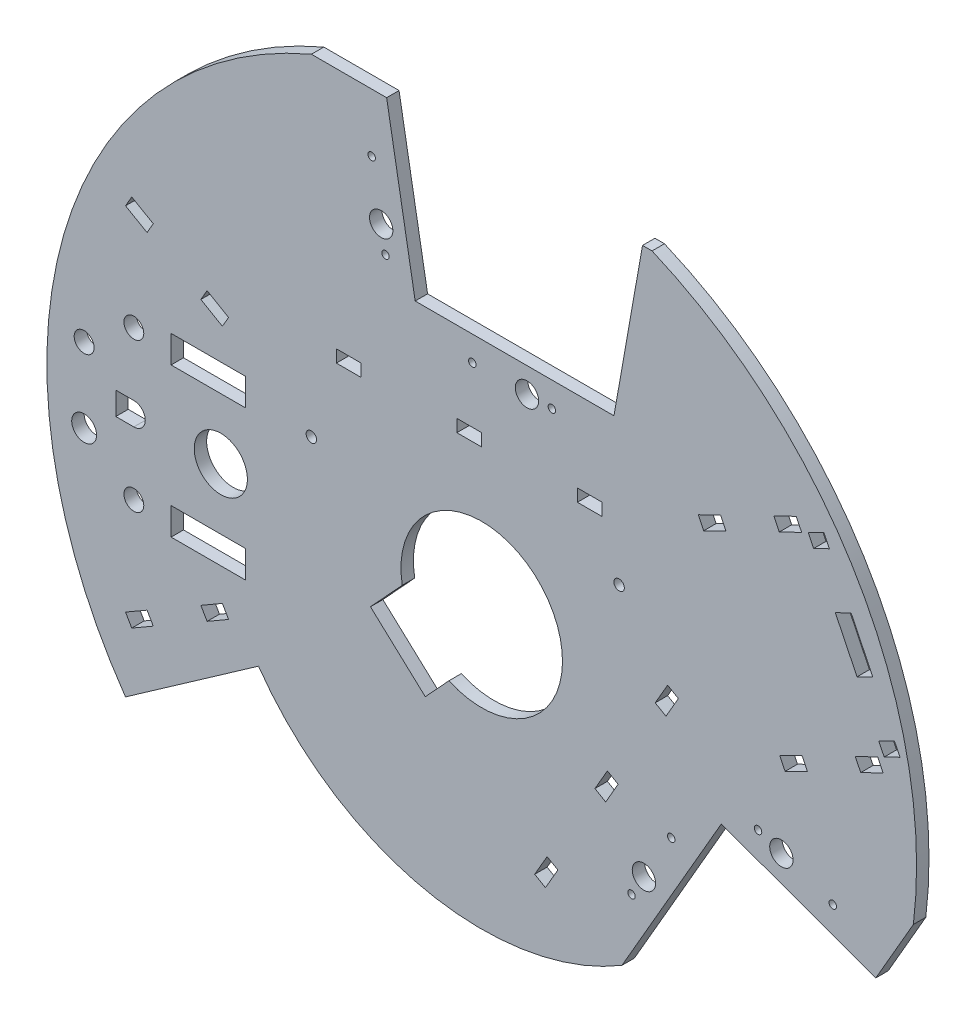
from build123d import *

# Parameters (mm, degrees)
ESQUISSE1_R                   = 175
BOSS_EXTRU_1_DEPTH            = 5
ESQUISSE2_R                   = 4.7
ENL_V_MAT_EXTRU_1_DEPTH       = 5
LEDS_BOUT_TIRETTE_R           = 10.7
LEDS_BOUT_TIRETTE_R_2         = 4
LEDS_BOUT_TIRETTE_R_3         = 5
LEDS_BOUT_TIRETTE_W           = 30
LEDS_BOUT_TIRETTE_H           = 11
LEDS_BUTTONS_DEPTH            = 10
FIXATION_ACENSSEURS_R         = 1.5
ENL_V_MAT_EXTRU_2_DEPTH       = 10
ENL_V_MAT_EXTRU_3_DEPTH       = 10
ENL_V_MAT_EXTRU_4_DEPTH       = 10
ENL_V_START                   = -2.417292656
ENL_V_MAT_EXTRU_5_OUTLINE_W   = 7.070312755
ENL_V_MAT_EXTRU_5_OUTLINE_H   = 5
ENL_V_MAT_EXTRU_5_DEPTH       = 20
ENL_V_START_2                 = -32.417292656
ENL_V_MAT_EXTRU_5_2_OUTLINE_W = 10
ENL_V_MAT_EXTRU_5_2_OUTLINE_H = 5
ENL_V_MAT_EXTRU_5_2_DEPTH     = 5
ENL_V_START_3                 = 42.582707344
ENL_V_MAT_EXTRU_5_3_OUTLINE_W = 10
ENL_V_MAT_EXTRU_5_3_OUTLINE_H = 5
ENL_V_MAT_EXTRU_5_3_DEPTH     = 5
ENL_V_START_4                 = -27.417292656
ENL_V_MAT_EXTRU_5_4_OUTLINE_W = 7.070312755
ENL_V_MAT_EXTRU_5_4_OUTLINE_H = 5
ENL_V_MAT_EXTRU_5_4_DEPTH     = 5
ENL_V_START_5                 = 37.582707344
ENL_V_MAT_EXTRU_5_5_OUTLINE_W = 7.070312755
ENL_V_MAT_EXTRU_5_5_OUTLINE_H = 5
ENL_V_MAT_EXTRU_5_5_DEPTH     = 5
ESQUISSE8_W                   = 10
ESQUISSE8_H                   = 5
ENL_V_MAT_EXTRU_6_DEPTH       = 5
ENL_V_MAT_EXTRU_7_DEPTH       = 10
TROU_TARAUD_M51_D             = 4.2


# Read off the part's stored shape, not the designer's step: Enlèv. mat.-Extru.5
with BuildPart() as part:
    # Esquisse1 → Boss.-Extru.1 (new body)
    with BuildSketch(Plane.XY):
        Circle(ESQUISSE1_R)
    extrude(amount=BOSS_EXTRU_1_DEPTH)

    # Esquisse2 → Enlèv. mat.-Extru.1 (cut)
    with BuildSketch(Plane(origin=(0, 0, 0), x_dir=(-1, 0, 0), z_dir=(0, 0, -1))):
        with Locations((-18.220426897, 85.887612711)):
            Circle(ESQUISSE2_R)
        with Locations((40.460378836, 115.887612711)):
            Circle(ESQUISSE2_R)
        with Locations((-65.270641029, -58.723158916)):
            Circle(ESQUISSE2_R)
        with Locations((-120.59180601, -22.904090436)):
            Circle(ESQUISSE2_R)
        Polygon((26.7795731, 95.88761271), (38.263317053, 161.015161015), (68.550112498, 161.015161015), (68.550112498, 190.246123658), (-94.990966298, 190.246123658), (-94.990966298, 161.015161015), (-64.704170853, 161.015161015), (-53.2204269, 95.88761271), align=None)
        Polygon((-96.430895065, -24.752015748), (-158.57487836, -47.370575906), (-173.718276082, -21.141441652), (-199.033032308, -35.756922974), (-117.262492911, -177.387651773), (-91.947736684, -162.772170451), (-107.091134406, -136.543036197), (-56.430895065, -94.034048051), align=None)
    extrude(amount=-ENL_V_MAT_EXTRU_1_DEPTH, mode=Mode.SUBTRACT)

    # Leds, bout., tirette → Leds, buttons (cut)
    with BuildSketch(Plane.XY.offset(5)):
        with Locations((-105, 0)):
            Circle(LEDS_BOUT_TIRETTE_R)
        with Locations((-140, 30)):
            Circle(LEDS_BOUT_TIRETTE_R_2)
        with Locations((-140, -30)):
            Circle(LEDS_BOUT_TIRETTE_R_2)
        with Locations((-160, 15)):
            Circle(LEDS_BOUT_TIRETTE_R_2)
        with Locations((-160, -15)):
            Circle(LEDS_BOUT_TIRETTE_R_3)
        with BuildLine():
            Line((-140, -4.6), (-147.25, -4.6))
            Line((-147.25, -4.6), (-147.25, 4.6))
            Line((-147.25, 4.6), (-140, 4.6))
            ThreePointArc((-140, 4.6), (-135.4, 0), (-140, -4.6))
        make_face()
        with Locations((-110, 30)):
            Rectangle(LEDS_BOUT_TIRETTE_W, LEDS_BOUT_TIRETTE_H)
        with Locations((-110, -30)):
            Rectangle(LEDS_BOUT_TIRETTE_W, LEDS_BOUT_TIRETTE_H)
    extrude(amount=-LEDS_BUTTONS_DEPTH, mode=Mode.SUBTRACT)

    # Fixation acensseurs → Enlèv. mat.-Extru.2 (cut)
    with BuildSketch(Plane(origin=(0, 0, 0), x_dir=(-1, 0, 0), z_dir=(0, 0, -1))):
        with Locations((38.72389706, 106.03953518)):
            Circle(FIXATION_ACENSSEURS_R)
        with Locations((-28.220426897, 85.887612711)):
            Circle(FIXATION_ACENSSEURS_R)
        with Locations((44.280638745, 137.553383277)):
            Circle(FIXATION_ACENSSEURS_R)
        with Locations((3.779573103, 85.887612711)):
            Circle(FIXATION_ACENSSEURS_R)
        with Locations((-111.194879802, -19.483889003)):
            Circle(FIXATION_ACENSSEURS_R)
        with Locations((-60.270641029, -67.383412953)):
            Circle(FIXATION_ACENSSEURS_R)
        with Locations((-141.265043667, -30.428533589)):
            Circle(FIXATION_ACENSSEURS_R)
        with Locations((-76.270641029, -39.670600032)):
            Circle(FIXATION_ACENSSEURS_R)
    extrude(amount=-ENL_V_MAT_EXTRU_2_DEPTH, mode=Mode.SUBTRACT)

    # Esquisse3 → Enlèv. mat.-Extru.3 (cut)
    with BuildSketch(Plane(origin=(0, 0, 0), x_dir=(-1, 0, 0), z_dir=(0, 0, -1))):
        with BuildLine():
            Line((22.704747883, -39.988138527), (44.77437947, -19.667425901))
            Line((44.77437947, -19.667425901), (31.982809207, -5.77493855))
            ThreePointArc((31.982809207, -5.77493855), (-25.570164707, 20.060325942), (13.221748658, -29.68897712))
            Line((13.221748658, -29.68897712), (22.704747883, -39.988138527))
        make_face()
    extrude(amount=-ENL_V_MAT_EXTRU_3_DEPTH, mode=Mode.SUBTRACT)

    # Esquisse4 → Enlèv. mat.-Extru.4 (cut)
    with BuildSketch(Plane(origin=(0, 0, -5), x_dir=(-1, 0, 0), z_dir=(0, 0, -1))):
        Polygon((134.678427666, -65.79510224), (143.338681704, -70.79510224), (140.838681704, -75.125229259), (132.178427666, -70.125229259), align=None)
        Polygon((101.867538534, -52.625229259), (110.527792572, -57.625229259), (113.027792572, -53.29510224), (104.367538534, -48.29510224), align=None)
        Polygon((104.367538534, 48.29510224), (101.867538534, 52.625229259), (110.527792572, 57.625229259), (113.027792572, 53.29510224), align=None)
        Polygon((132.178427666, 70.125229259), (134.678427666, 65.79510224), (143.338681704, 70.79510224), (140.838681704, 75.125229259), align=None)
    extrude(amount=-ENL_V_MAT_EXTRU_4_DEPTH, mode=Mode.SUBTRACT)

    # Enlèv. mat.-Extru.5 outline → Enlèv. mat.-Extru.5 (cut)
    with BuildSketch(Plane(origin=(0, 0, 0), x_dir=(0.899482426544107, 0.4369569364803871, 0), z_dir=(0.4369569364803871, -0.8994824265441071, 0)).offset(ENL_V_START)):
        with Locations((162.91185011, 2.5)):
            Rectangle(ENL_V_MAT_EXTRU_5_OUTLINE_W, ENL_V_MAT_EXTRU_5_OUTLINE_H)
    extrude(amount=ENL_V_MAT_EXTRU_5_DEPTH, mode=Mode.SUBTRACT)

    # Enl_v. mat.-Extru.5 2 outline → Enl_v. mat.-Extru.5 2 (cut)
    with BuildSketch(Plane(origin=(0, 0, 0), x_dir=(0.899482426544107, 0.4369569364803871, 0), z_dir=(0.4369569364803871, -0.8994824265441071, 0)).offset(ENL_V_START_2)):
        with Locations((117.627599257, 2.5)):
            Rectangle(ENL_V_MAT_EXTRU_5_2_OUTLINE_W, ENL_V_MAT_EXTRU_5_2_OUTLINE_H)
        with Locations((151.447761545, 2.5)):
            Rectangle(ENL_V_MAT_EXTRU_5_2_OUTLINE_W, ENL_V_MAT_EXTRU_5_2_OUTLINE_H)
    extrude(amount=ENL_V_MAT_EXTRU_5_2_DEPTH, mode=Mode.SUBTRACT)

    # Enl_v. mat.-Extru.5 3 outline → Enl_v. mat.-Extru.5 3 (cut)
    with BuildSketch(Plane(origin=(0, 0, 0), x_dir=(0.899482426544107, 0.4369569364803871, 0), z_dir=(0.4369569364803871, -0.8994824265441071, 0)).offset(ENL_V_START_3)):
        with Locations((117.627599257, 2.5)):
            Rectangle(ENL_V_MAT_EXTRU_5_3_OUTLINE_W, ENL_V_MAT_EXTRU_5_3_OUTLINE_H)
        with Locations((151.447761545, 2.5)):
            Rectangle(ENL_V_MAT_EXTRU_5_3_OUTLINE_W, ENL_V_MAT_EXTRU_5_3_OUTLINE_H)
    extrude(amount=ENL_V_MAT_EXTRU_5_3_DEPTH, mode=Mode.SUBTRACT)

    # Enl_v. mat.-Extru.5 4 outline → Enl_v. mat.-Extru.5 4 (cut)
    with BuildSketch(Plane(origin=(0, 0, 0), x_dir=(0.899482426544107, 0.4369569364803871, 0), z_dir=(0.4369569364803871, -0.8994824265441071, 0)).offset(ENL_V_START_4)):
        with Locations((162.91185011, 2.5)):
            Rectangle(ENL_V_MAT_EXTRU_5_4_OUTLINE_W, ENL_V_MAT_EXTRU_5_4_OUTLINE_H)
    extrude(amount=ENL_V_MAT_EXTRU_5_4_DEPTH, mode=Mode.SUBTRACT)

    # Enl_v. mat.-Extru.5 5 outline → Enl_v. mat.-Extru.5 5 (cut)
    with BuildSketch(Plane(origin=(0, 0, 0), x_dir=(0.899482426544107, 0.4369569364803871, 0), z_dir=(0.4369569364803871, -0.8994824265441071, 0)).offset(ENL_V_START_5)):
        with Locations((162.91185011, 2.5)):
            Rectangle(ENL_V_MAT_EXTRU_5_5_OUTLINE_W, ENL_V_MAT_EXTRU_5_5_OUTLINE_H)
    extrude(amount=ENL_V_MAT_EXTRU_5_5_DEPTH, mode=Mode.SUBTRACT)

    # Esquisse8 → Enlèv. mat.-Extru.6 (cut)
    with BuildSketch(Plane(origin=(0, 0, 0), x_dir=(-1, 0, 0), z_dir=(0, 0, -1))):
        with Locations((53.5, 60.88761271)):
            Rectangle(ESQUISSE8_W, ESQUISSE8_H)
        with Locations((5, 60.88761271)):
            Rectangle(ESQUISSE8_W, ESQUISSE8_H)
        with Locations((-43.5, 60.88761271)):
            Rectangle(ESQUISSE8_W, ESQUISSE8_H)
        Polygon((-79.145282892, 10.308425729), (-74.145282892, 1.648171691), (-69.815155873, 4.148171691), (-74.815155873, 12.808425729), align=None)
        Polygon((-54.895282892, -31.693806355), (-49.895282892, -40.354060393), (-45.565155873, -37.854060393), (-50.565155873, -29.193806355), align=None)
        Polygon((-21.315155873, -79.856292476), (-26.315155873, -71.196038439), (-30.645282892, -73.696038439), (-25.645282892, -82.356292476), align=None)
    extrude(amount=-ENL_V_MAT_EXTRU_6_DEPTH, mode=Mode.SUBTRACT)

    # Esquisse9 → Enlèv. mat.-Extru.7 (cut)
    with BuildSketch(Plane(origin=(0, 0, 0), x_dir=(-1, 0, 0), z_dir=(0, 0, -1))):
        with BuildLine():
            Line((143.351607751, -100.375876361), (89.833936865, -62.90239978))
            ThreePointArc((89.833936865, -62.90239978), (22.830586532, -107.264217842), (-56.430895065, -94.034048051))
            Line((-56.430895065, -94.034048051), (-107.091134406, -136.543036197))
            Line((-107.091134406, -136.543036197), (-105.168163584, -139.873719363))
            ThreePointArc((-105.168163584, -139.873719363), (38.840643584, -244.384683529), (143.351607751, -100.375876361))
        make_face()
    extrude(amount=-ENL_V_MAT_EXTRU_7_DEPTH, mode=Mode.SUBTRACT)

    # Trou taraudé M51 (through all)
    with Locations(Plane(origin=(0, 0, -5), x_dir=(1, 0, 0), z_dir=(0, 0, -1))):
        with Locations((-68.568956805, -27.662548456), (55.280905682, -37.98337033), (-87.299337242, 135.559338217)):
            Hole(TROU_TARAUD_M51_D / 2)


solid = part.part
